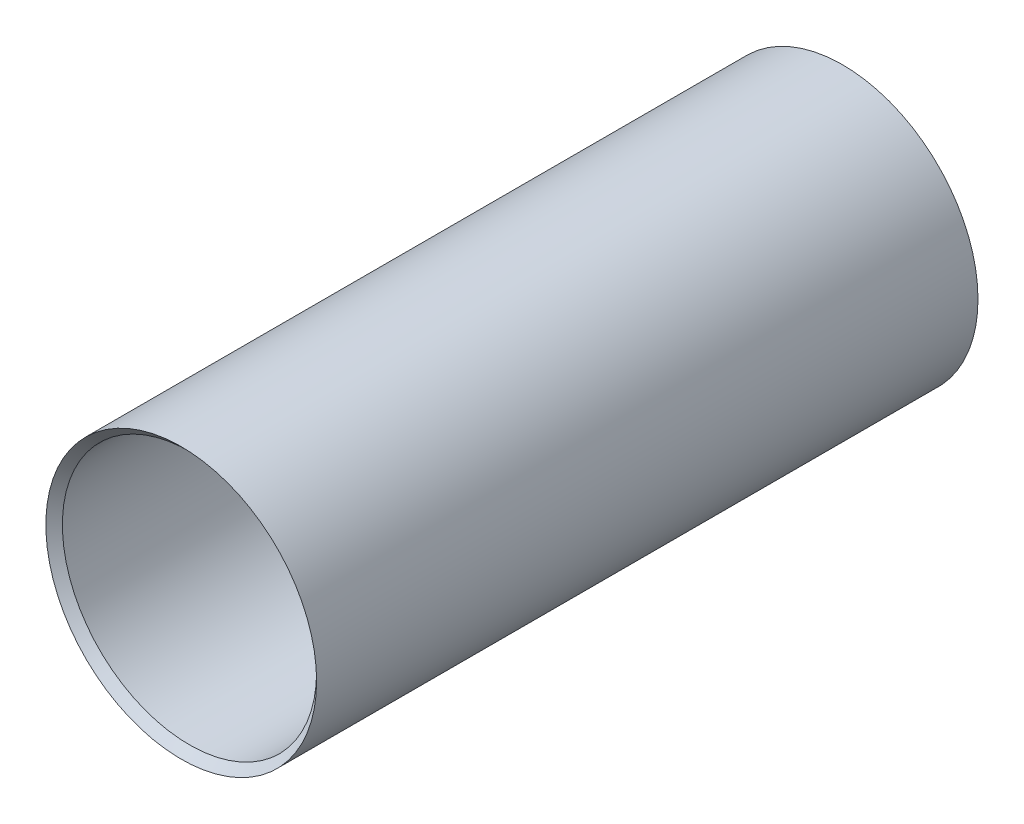
from build123d import *

# Parameters (mm, degrees)
SKETCH1_R           = 32.75
BOSS_EXTRUDE1_DEPTH = 80.75
SKETCH12_R          = 6
BOSS_EXTRUDE5_DEPTH = 63
SKETCH14_R          = 3
CUT_EXTRUDE2_DEPTH  = 10
CIRPATTERN2_COUNT   = 4
CUT_EXTRUDE5_START  = -1.5
SKETCH17_R          = 50
CUT_EXTRUDE5_DEPTH  = 170.510044343
SHELL1_T            = -2
CHAMFER2_SIZE       = 2


with BuildPart() as part:
    # Sketch1 → Boss-Extrude1 (new, symmetric)
    with BuildSketch(Plane.XY):
        Circle(SKETCH1_R)
    extrude(amount=BOSS_EXTRUDE1_DEPTH, both=True)

    # Sketch10 → Revolve1 (revolve)
    with BuildSketch(Plane(origin=(0, 0, 0), x_dir=(0, 0, -1), z_dir=(1, 0, 0)), mode=Mode.PRIVATE) as revolve1_sk:
        Polygon((-97.75, 0), (-97.75, 14), (-80.75, 19), (-80.75, 0), align=None)
    revolve(revolve1_sk.sketch.rotate(Axis((0, 0, 1000), (0, 0, -1)), 90), axis=Axis((0, 0, 1000), (0, 0, -1)))

    # Sketch12 → Boss-Extrude5 (add)
    with BuildSketch(Plane.XY.offset(97.75)):
        Circle(SKETCH12_R)
    extrude(amount=BOSS_EXTRUDE5_DEPTH)

    # Sketch14 → Cut-Extrude2 (cut)
    with BuildSketch(Plane(origin=(0, 0, -80.75), x_dir=(-1, 0, 0), z_dir=(0, 0, -1))):
        with Locations((21, 0)):
            Circle(SKETCH14_R)
    cut_extrude2 = extrude(amount=-CUT_EXTRUDE2_DEPTH, mode=Mode.SUBTRACT)

    # CirPattern2: Cut-Extrude2 ×4 about axis
    cirpattern2_axis = Axis((0, 0, 0), (0, 0, 1))
    for i in range(1, CIRPATTERN2_COUNT):
        add(cut_extrude2.rotate(cirpattern2_axis, i * 360 / CIRPATTERN2_COUNT), mode=Mode.SUBTRACT)

    # Sketch17 → Cut-Extrude5 (cut, through all)
    with BuildSketch(Plane.XY.offset(80.75).offset(CUT_EXTRUDE5_START)):
        Circle(SKETCH17_R)
    extrude(amount=CUT_EXTRUDE5_DEPTH, mode=Mode.SUBTRACT)

    # Shell1
    shell1_openings = [part.faces().sort_by_distance(p)[0] for p in [
        (0, 0, 79.25),
    ]]
    offset(amount=SHELL1_T, openings=shell1_openings, kind=Kind.INTERSECTION)

    # Chamfer2
    chamfer2_edges = [part.edges().sort_by_distance(p)[0] for p in [
        (-30.75, 0, 79.25),
    ]]
    chamfer(chamfer2_edges, length=CHAMFER2_SIZE - 0.0001)  # a hair under: the kernel refuses the full size


solid = part.part
